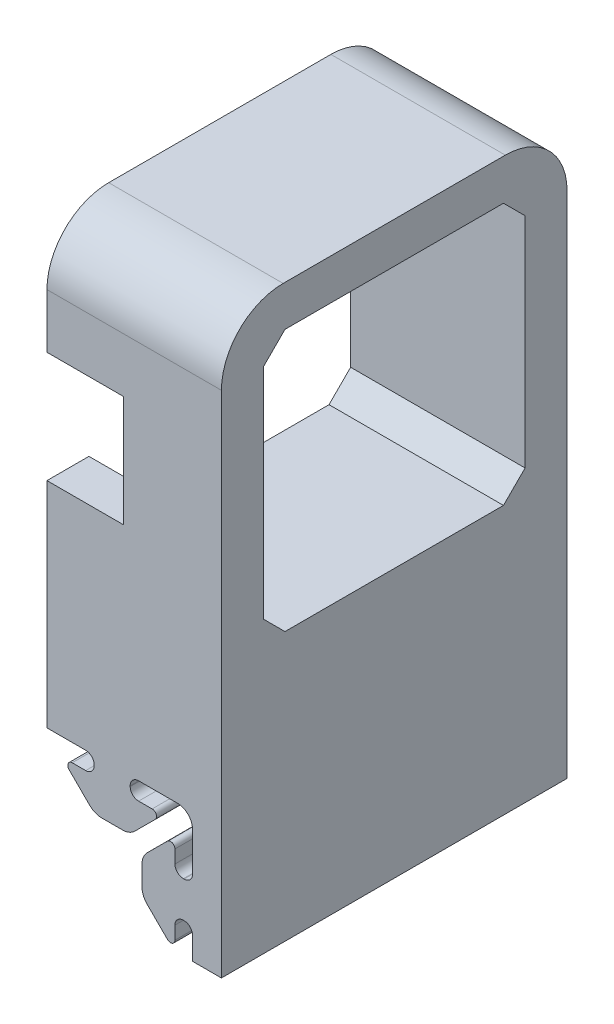
from build123d import *

# Parameters (mm, degrees)
BOSS_EXTRUDE1_DEPTH = 56
SKETCH14_W          = 42.4
SKETCH14_H          = 42.4
CUT_EXTRUDE1_DEPTH  = 56
CHAMFER1_SIZE       = 3.5
FILLET1_R           = 10
CUT_EXTRUDE4_REACH  = 104.922
SKETCH17_W          = 15.453545708
SKETCH17_H          = 18


with BuildPart() as part:
    # Sketch1 → Boss-Extrude1 (new body)
    with BuildSketch(Plane.XY):
        with BuildLine():
            Line((13.02, -7.9417418), (17.7, -7.9417418))
            Line((17.7, -7.9417418), (17.7, 84.52))
            Line((17.7, 84.52), (-10.566443095, 84.52))
            Line((-10.566443095, 84.52), (-10.566443095, 13.02))
            Line((-10.566443095, 13.02), (-5.317126718, 13.02))
            Line((-5.317126718, 13.02), (-4.287512407, 13.02))
            ThreePointArc((-4.287512407, 13.02), (-3.319474451, 12.619025549), (-2.9185, 11.650987593))
            Line((-2.9185, 11.650987593), (-2.9185, 11.539212407))
            ThreePointArc((-2.9185, 11.539212407), (-3.319474451, 10.571174451), (-4.287512407, 10.1702))
            Line((-4.287512407, 10.1702), (-6.476788598, 10.1702))
            ThreePointArc((-6.476788598, 10.1702), (-7.136510935, 9.729114651), (-6.981020848, 8.950903446))
            Line((-6.981020848, 8.950903446), (-3.672257405, 5.649701928))
            ThreePointArc((-3.672257405, 5.649701928), (-2.746830644, 5.032499411), (-1.655778399, 4.8158))
            Line((-1.655778399, 4.8158), (1.655778399, 4.8158))
            ThreePointArc((1.655778399, 4.8158), (2.746830644, 5.032499411), (3.672257405, 5.649701928))
            Line((3.672257405, 5.649701928), (6.981020848, 8.950903446))
            ThreePointArc((6.981020848, 8.950903446), (7.136510935, 9.729114651), (6.476788598, 10.1702))
            Line((6.476788598, 10.1702), (4.287512407, 10.1702))
            ThreePointArc((4.287512407, 10.1702), (3.319474451, 10.571174451), (2.9185, 11.539212407))
            Line((2.9185, 11.539212407), (2.9185, 11.650987593))
            ThreePointArc((2.9185, 11.650987593), (3.319474451, 12.619025549), (4.287512407, 13.02))
            Line((4.287512407, 13.02), (6.332886163, 13.02))
            Line((6.332886163, 13.02), (10.562594215, 13.019824354))
            ThreePointArc((10.562594215, 13.019824354), (12.303594776, 12.313982883), (13.019956614, 10.577284622))
            Line((13.019956614, 10.577284622), (13.02, 4.287469289))
            ThreePointArc((13.02, 4.287469289), (12.619025549, 3.319431332), (11.650987593, 2.918456882))
            Line((11.650987593, 2.918456882), (11.539212407, 2.918456882))
            ThreePointArc((11.539212407, 2.918456882), (10.571174451, 3.319431332), (10.1702, 4.287469289))
            Line((10.1702, 4.287469289), (10.1702, 6.402089023))
            ThreePointArc((10.1702, 6.402089023), (9.733877283, 7.055496588), (8.963146507, 6.90287605))
            Line((8.963146507, 6.90287605), (5.667020993, 3.614283579))
            ThreePointArc((5.667020993, 3.614283579), (5.046449321, 2.687255303), (4.8285, 1.593185507))
            Line((4.8285, 1.593185507), (4.8285, -1.593185507))
            ThreePointArc((4.8285, -1.593185507), (5.046449321, -2.687255303), (5.667020993, -3.614283579))
            Line((5.667020993, -3.614283579), (8.963146507, -6.90287605))
            ThreePointArc((8.963146507, -6.90287605), (9.733877283, -7.055496588), (10.1702, -6.402089023))
            Line((10.1702, -6.402089023), (10.1702, -4.287469289))
            ThreePointArc((10.1702, -4.287469289), (10.571174451, -3.319431332), (11.539212407, -2.918456882))
            Line((11.539212407, -2.918456882), (11.650987593, -2.918456882))
            ThreePointArc((11.650987593, -2.918456882), (12.619025549, -3.319431332), (13.02, -4.287469289))
            Line((13.02, -4.287469289), (13.02, -5.3170836))
            Line((13.02, -5.3170836), (13.02, -7.9417418))
        make_face()
    extrude(amount=BOSS_EXTRUDE1_DEPTH)

    # Sketch14 → Cut-Extrude1 (cut)
    with BuildSketch(Plane(origin=(17.7, 0, 0), x_dir=(0, 0, -1), z_dir=(1, 0, 0))):
        with Locations((-28, 56.72)):
            Rectangle(SKETCH14_W, SKETCH14_H)
    extrude(amount=-CUT_EXTRUDE1_DEPTH, mode=Mode.SUBTRACT)

    # Chamfer1
    chamfer1_edges = [part.edges().sort_by_distance(p)[0] for p in [
        (3.566778452, 35.52, 6.8),
        (3.566778452, 35.52, 49.2),
        (3.566778452, 77.92, 6.8),
        (3.566778452, 77.92, 49.2),
    ]]
    chamfer(chamfer1_edges, length=CHAMFER1_SIZE)

    # Fillet1
    fillet1_edges = [part.edges().sort_by_distance(p)[0] for p in [
        (3.566778452, 84.52, 56),
        (3.566778452, 84.52, 0),
    ]]
    fillet(fillet1_edges, radius=FILLET1_R)

    # Sketch17 → Cut-Extrude4 (cut, up to next)
    with BuildSketch(Plane.XY.offset(56), mode=Mode.PRIVATE) as cut_extrude4_sk1:
        with Locations((-5.893215949, 56.72)):
            Rectangle(SKETCH17_W, SKETCH17_H)
    cut_extrude4_tool1 = extrude(cut_extrude4_sk1.sketch, amount=-CUT_EXTRUDE4_REACH, mode=Mode.PRIVATE) & part.part
    add(cut_extrude4_tool1.solids().sort_by_distance((-5.893216, 56.72, 56))[0], mode=Mode.SUBTRACT)


solid = part.part
